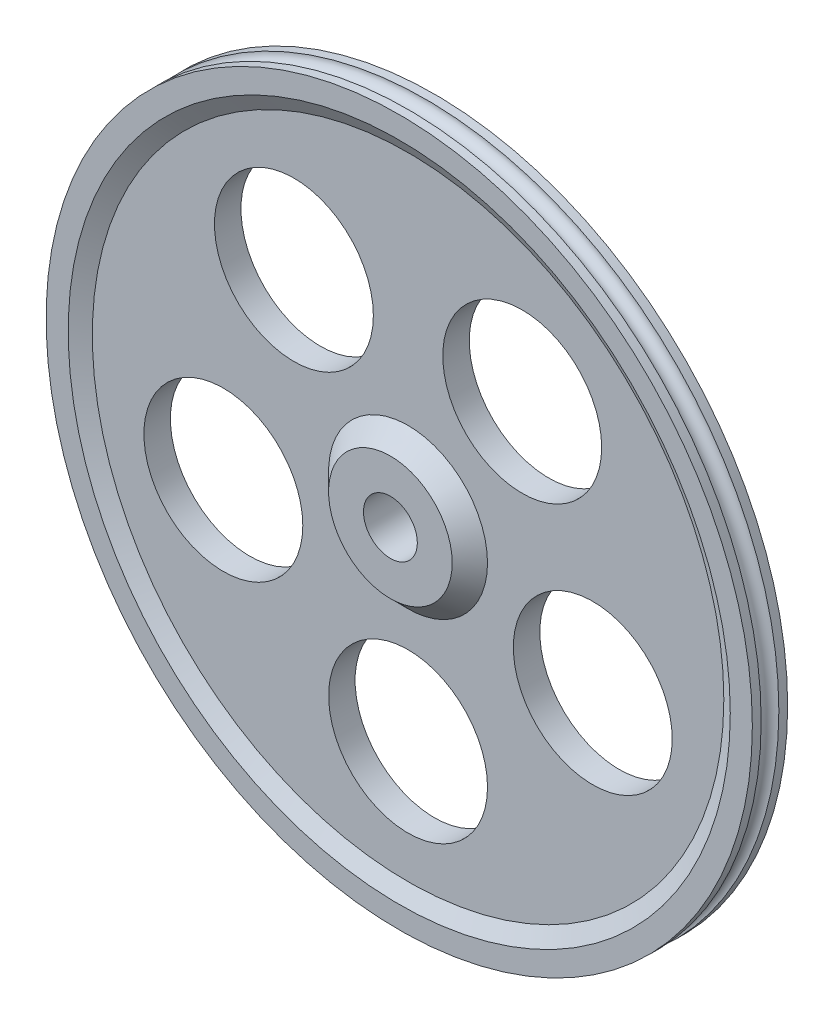
from build123d import *

# Parameters (mm, degrees)
SKETCH2_W          = 7
SKETCH2_H          = 1
SKETCH3_R          = 3.05
CUT_EXTRUDE1_DEPTH = 57.789083458
CHAMFER1_SIZE      = 2
SKETCH4_R          = 9
CUT_EXTRUDE2_DEPTH = 57.648036153


with BuildPart() as part:
    # Sketch2 → Revolve1 (revolve)
    with BuildSketch(Plane(origin=(0, 0, 0), x_dir=(1, 0, 0), z_dir=(0, 1, 0))):
        with Locations((3.5, -2.5)):
            Rectangle(SKETCH2_W, SKETCH2_H)
        with BuildLine():
            Line((0, 2), (0, -2))
            Line((0, -2), (7, -2))
            Line((7, -2), (7, -1))
            Line((7, -1), (35.767949192, -1))
            Line((35.767949192, -1), (37.5, -2))
            Line((37.5, -2), (40, -2))
            Line((40, -2), (40, -1))
            ThreePointArc((40, -1), (39, 0), (40, 1))
            Line((40, 1), (40, 2))
            Line((40, 2), (0, 2))
        make_face()
    revolve(axis=Axis((0, 0, 2), (0, 0, -1)))

    # Sketch3 → Cut-Extrude1 (cut, through all)
    with BuildSketch(Plane.XY.offset(3)):
        Circle(SKETCH3_R)
    extrude(amount=-CUT_EXTRUDE1_DEPTH, mode=Mode.SUBTRACT)

    # Chamfer1
    chamfer1_edges = [part.edges().sort_by_distance(p)[0] for p in [
        (-7, 0, 1),
    ]]
    chamfer(chamfer1_edges, length=CHAMFER1_SIZE - 0.0001)  # a hair under: the kernel refuses the full size

    # Sketch4 → Cut-Extrude2 (cut, through all)
    with BuildSketch(Plane.XY.offset(1)):
        with Locations((0, -22)):
            Circle(SKETCH4_R)
        with Locations((-20.923243358, -6.798373876)):
            Circle(SKETCH4_R)
        with Locations((-12.93127555, 17.798373876)):
            Circle(SKETCH4_R)
        with Locations((12.93127555, 17.798373876)):
            Circle(SKETCH4_R)
        with Locations((20.923243358, -6.798373876)):
            Circle(SKETCH4_R)
    extrude(amount=-CUT_EXTRUDE2_DEPTH, mode=Mode.SUBTRACT)


solid = part.part
